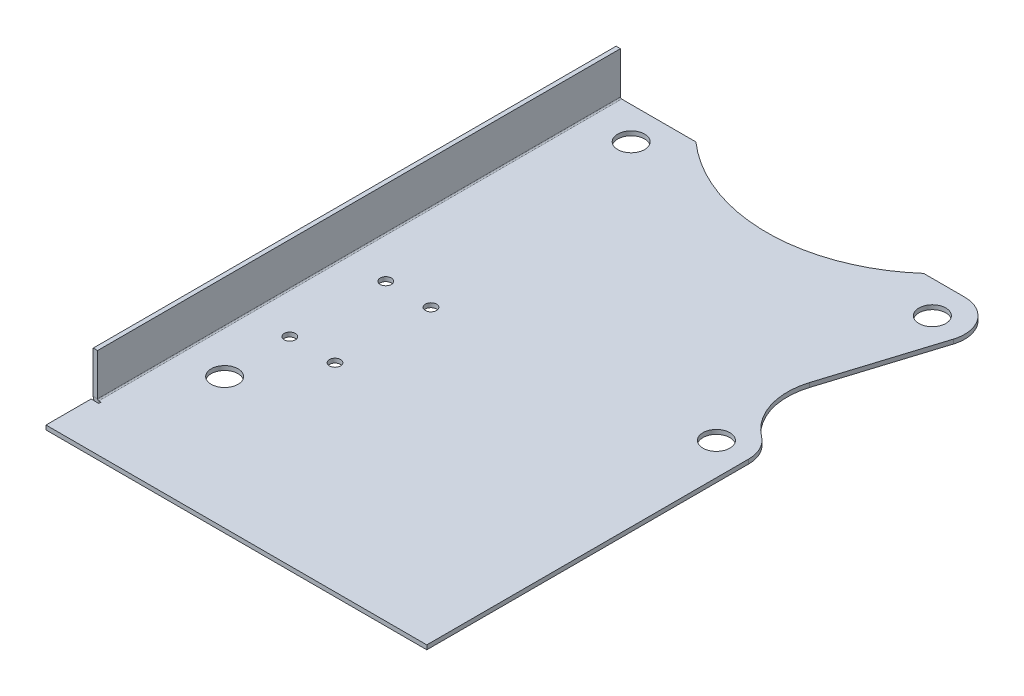
from build123d import *

# Parameters (mm, degrees)
SKETCH1_R                     = 7.9375
SKETCH1_R_2                   = 3.302
BASE_FLANGE1_DEPTH            = 2.54
EDGE_FLANGE1_STRIP_W          = 11.6332
EDGE_FLANGE1_STRIP_H          = 2.54
EDGE_FLANGE1_STRIP_CUT_DEPTH  = 308.6735
EDGE_FLANGE1_RELIEF_W         = 12.9032
EDGE_FLANGE1_RELIEF_H         = 1.27
EDGE_FLANGE1_RELIEF_CUT_DEPTH = 2.54
EDGE_FLANGE1_DEPTH            = 308.6735


# Sheet-metal steps are written as plain solids
with BuildPart() as part:
    # Sketch1 → Base-Flange1 (new body)
    with BuildSketch(Plane(origin=(0, 0, 0), x_dir=(1, 0, 0), z_dir=(0, 1, 0))):
        with BuildLine():
            Line((109.619528436, 311.807263764), (89.361961148, 247.115522342))
            ThreePointArc((89.361961148, 247.115522342), (89.460566801, 224.034337943), (102.867006006, 205.245559798))
            ThreePointArc((102.867006006, 205.245559798), (108.478001121, 198.524407286), (110.49, 190.003314763))
            Line((110.49, 190.003314763), (110.49, 0))
            Line((110.49, 0), (-114.3, 0))
            Line((-114.3, 0), (-114.3, 336.55))
            Line((-114.3, 336.55), (-67.202083301, 336.55))
            ThreePointArc((-67.202083301, 336.55), (0, 311.15), (67.202083301, 336.55))
            Line((67.202083301, 336.55), (91.44, 336.55))
            ThreePointArc((91.44, 336.55), (106.791695758, 328.779536221), (109.619528436, 311.807263764))
        make_face()
        with Locations(Location((-86.36, 317.5, 0), (0, 0, 270))):
            Circle(SKETCH1_R, mode=Mode.SUBTRACT)
        with Locations(Location((91.44, 317.5, 0), (0, 0, 270))):
            Circle(SKETCH1_R, mode=Mode.SUBTRACT)
        with Locations(Location((91.44, 190.003314763, 0), (0, 0, 270))):
            Circle(SKETCH1_R, mode=Mode.SUBTRACT)
        with Locations(Location((-86.36, 77.503314763, 0), (0, 0, 270))):
            Circle(SKETCH1_R, mode=Mode.SUBTRACT)
        with Locations(Location((-60.8584, 173.787563647, 0), (0, 0, 270))):
            Circle(SKETCH1_R_2, mode=Mode.SUBTRACT)
        with Locations(Location((-87.5284, 173.787563647, 0), (0, 0, 270))):
            Circle(SKETCH1_R_2, mode=Mode.SUBTRACT)
        with Locations(Location((-60.8584, 117.145563647, 0), (0, 0, 270))):
            Circle(SKETCH1_R_2, mode=Mode.SUBTRACT)
        with Locations(Location((-87.5284, 117.145563647, 0), (0, 0, 270))):
            Circle(SKETCH1_R_2, mode=Mode.SUBTRACT)
    extrude(amount=-BASE_FLANGE1_DEPTH)

    # Edge-Flange1 strip (across the edge) → Edge-Flange1 strip cut (cut)
    with BuildSketch(Plane(origin=(-114.3, 0, -336.55), x_dir=(1, 0, 0), z_dir=(0, 0, 1))):
        with Locations((-2.54, -1.27)):
            Rectangle(EDGE_FLANGE1_STRIP_W, EDGE_FLANGE1_STRIP_H)
    extrude(amount=EDGE_FLANGE1_STRIP_CUT_DEPTH, mode=Mode.SUBTRACT)

    # Edge-Flange1 relief (on the sheet) → Edge-Flange1 relief cut (cut)
    with BuildSketch(Plane(origin=(-111.0234, 0, -336.55), x_dir=(1, 0, 0), z_dir=(0, 1, 0))):
        with Locations((-5.1816, -309.3085)):
            Rectangle(EDGE_FLANGE1_RELIEF_W, EDGE_FLANGE1_RELIEF_H)
    extrude(amount=-EDGE_FLANGE1_RELIEF_CUT_DEPTH, mode=Mode.SUBTRACT)

    # Edge-Flange1 section (across the edge) → Edge-Flange1 (add)
    with BuildSketch(Plane(origin=(-114.3, 0, -336.55), x_dir=(1, 0, 0), z_dir=(0, 0, 1))):
        with BuildLine():
            Line((0, 0.7366), (0, 25.4))
            Line((0, 25.4), (2.54, 25.4))
            Line((2.54, 25.4), (2.54, 0.7366))
            ThreePointArc((2.54, 0.7366), (2.755745145, 0.215745145), (3.2766, 0))
            Line((3.2766, 0), (3.2766, -2.54))
            ThreePointArc((3.2766, -2.54), (0.959693921, -1.580306079), (0, 0.7366))
        make_face()
    extrude(amount=EDGE_FLANGE1_DEPTH)


solid = part.part
